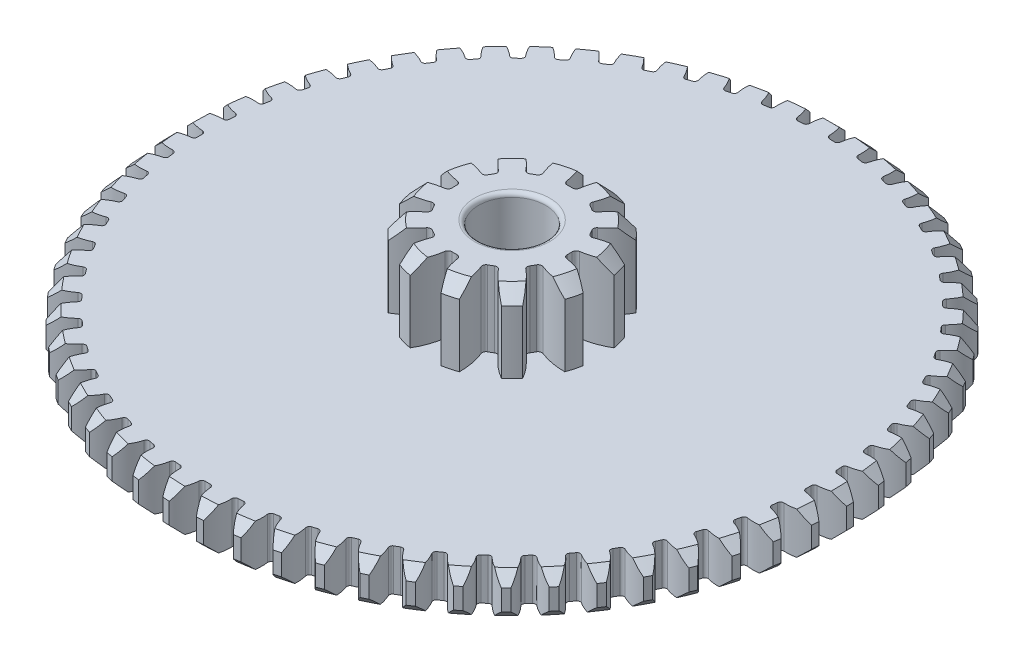
from build123d import *

# Parameters (mm, degrees)
SKETCH1_R                = 2.1
BOSS_EXTRUDE1_DEPTH      = 1.8
CUT_EXTRUDE1_REACH       = 5.473
FILLET1_R                = 0.09
CHAMFER1_SIZE            = 0.3
CIRPATTERN1_COUNT        = 12
FILLET1_OF_CIRPATTERN1_R = 0.09
SKETCH3_R                = 7.875
BOSS_EXTRUDE2_DEPTH      = 1
CUT_EXTRUDE2_REACH       = 13.484
FILLET2_R                = 0.075
CHAMFER2_SIZE            = 0.25
CIRPATTERN2_COUNT        = 61
FILLET2_OF_CIRPATTERN2_R = 0.075
SKETCH5_R                = 0.8
CUT_EXTRUDE3_DEPTH       = 12.482883204
FILLET3_R                = 0.1


with BuildPart() as part:
    # Sketch1 → Boss-Extrude1 (new body)
    with BuildSketch(Plane(origin=(0, 0, 0), x_dir=(1, 0, 0), z_dir=(0, 1, 0))):
        Circle(SKETCH1_R)
    extrude(amount=BOSS_EXTRUDE1_DEPTH)

    # Sketch2 → Cut-Extrude1 (cut, up to next)
    with BuildSketch(Plane(origin=(0, 1.8, 0), x_dir=(1, 0, 0), z_dir=(0, 1, 0)), mode=Mode.PRIVATE) as cut_extrude1_sk1:
        with BuildLine():
            ThreePointArc((-0.140478266, 1.372831329), (-0.216904263, 1.732429305), (-0.368251981, 2.06745991))
            ThreePointArc((-0.368251981, 2.06745991), (0, 2.1), (0.368251981, 2.06745991))
            ThreePointArc((0.368251981, 2.06745991), (0.216904263, 1.732429305), (0.140478266, 1.372831329))
            ThreePointArc((0.140478266, 1.372831329), (0, 1.38), (-0.140478266, 1.372831329))
        make_face()
    cut_extrude1_tool1 = extrude(cut_extrude1_sk1.sketch, amount=-CUT_EXTRUDE1_REACH, mode=Mode.PRIVATE) & part.part
    cut_extrude1 = cut_extrude1_tool1.solids().sort_by_distance((0, 1.8, -1.794061))[0]
    add(cut_extrude1, mode=Mode.SUBTRACT)

    # Fillet1
    fillet1_edges = [part.edges().sort_by_distance(p)[0] for p in [
        (0.140478266, 0.9, -1.372831329),
        (-0.140478266, 0.9, -1.372831329),
    ]]
    fillet(fillet1_edges, radius=FILLET1_R)

    # Chamfer1
    chamfer1_edges = [part.edges().sort_by_distance(p)[0] for p in [
        (0, 1.8, 2.1),
    ]]
    chamfer(chamfer1_edges, length=CHAMFER1_SIZE)

    # CirPattern1: Cut-Extrude1 ×12 about axis
    cirpattern1_axis = Axis((0, 1.8, 0), (0, -1, 0))
    for i in range(1, CIRPATTERN1_COUNT):
        add(cut_extrude1.rotate(cirpattern1_axis, i * 360 / CIRPATTERN1_COUNT), mode=Mode.SUBTRACT)

    # Fillet1 of CirPattern1
    fillet1_of_cirpattern1_edges = [part.edges().sort_by_distance(p)[0] for p in [
        (0.808073411, 0.9, -1.118667673),
        (0.564757917, 0.9, -1.259145939),
        (1.259145939, 0.9, -0.564757917),
        (1.118667673, 0.9, -0.808073411),
        (1.372831329, 0.9, 0.140478266),
        (1.372831329, 0.9, -0.140478266),
        (1.118667673, 0.9, 0.808073411),
        (1.259145939, 0.9, 0.564757917),
        (0.564757917, 0.9, 1.259145939),
        (0.808073411, 0.9, 1.118667673),
        (-0.140478266, 0.9, 1.372831329),
        (0.140478266, 0.9, 1.372831329),
        (-0.808073411, 0.9, 1.118667673),
        (-0.564757917, 0.9, 1.259145939),
        (-1.259145939, 0.9, 0.564757917),
        (-1.118667673, 0.9, 0.808073411),
        (-1.372831329, 0.9, -0.140478266),
        (-1.372831329, 0.9, 0.140478266),
        (-1.118667673, 0.9, -0.808073411),
        (-1.259145939, 0.9, -0.564757917),
        (-0.564757917, 0.9, -1.259145939),
        (-0.808073411, 0.9, -1.118667673),
    ]]
    fillet(fillet1_of_cirpattern1_edges, radius=FILLET1_OF_CIRPATTERN1_R)

    # Sketch3 → Boss-Extrude2 (add)
    with BuildSketch(Plane.XZ):
        Circle(SKETCH3_R)
    extrude(amount=BOSS_EXTRUDE2_DEPTH)

    # Sketch4 → Cut-Extrude2 (cut, up to next)
    with BuildSketch(Plane.XZ.offset(1), mode=Mode.PRIVATE) as cut_extrude2_sk1:
        with BuildLine():
            ThreePointArc((-0.323725699, 7.868343324), (-0.183569923, 7.58532467), (-0.131592414, 7.273809761))
            ThreePointArc((-0.131592414, 7.273809761), (0, 7.275), (0.131592414, 7.273809761))
            ThreePointArc((0.131592414, 7.273809761), (0.183569923, 7.58532467), (0.323725699, 7.868343324))
            ThreePointArc((0.323725699, 7.868343324), (0, 7.875), (-0.323725699, 7.868343324))
        make_face()
    cut_extrude2_tool1 = extrude(cut_extrude2_sk1.sketch, amount=-CUT_EXTRUDE2_REACH, mode=Mode.PRIVATE) & part.part
    cut_extrude2 = cut_extrude2_tool1.solids().sort_by_distance((0, -1, 7.622319))[0]
    add(cut_extrude2, mode=Mode.SUBTRACT)

    # Fillet2
    fillet2_edges = [part.edges().sort_by_distance(p)[0] for p in [
        (0.131592414, -0.5, 7.273809761),
        (-0.131592414, -0.5, 7.273809761),
    ]]
    fillet(fillet2_edges, radius=FILLET2_R)

    # Chamfer2
    chamfer2_edges = [part.edges().sort_by_distance(p)[0] for p in [
        (-5.452810519, 0, -5.681767545),
        (-5.452810519, -1, -5.681767545),
    ]]
    chamfer(chamfer2_edges, length=CHAMFER2_SIZE)

    # CirPattern2: Cut-Extrude2 ×61 about axis
    cirpattern2_axis = Axis((0, -1, 0), (0, 1, 0))
    for i in range(1, CIRPATTERN2_COUNT):
        add(cut_extrude2.rotate(cirpattern2_axis, i * 360 / CIRPATTERN2_COUNT), mode=Mode.SUBTRACT)

    # Fillet2 of CirPattern2
    fillet2_of_cirpattern2_edges = [part.edges().sort_by_distance(p)[0] for p in [
        (0.87879533, -0.5, 7.221727201),
        (0.617005415, -0.5, 7.248788128),
        (1.616682797, -0.5, 7.093092537),
        (1.359062833, -0.5, 7.146927537),
        (2.337433025, -0.5, 6.889269327),
        (2.086713847, -0.5, 6.969307736),
        (3.033405881, -0.5, 6.612418148),
        (2.792245175, -0.5, 6.71781154),
        (3.69722388, -0.5, 6.265473692),
        (3.468178009, -0.5, 6.39510487),
        (4.321850386, -0.5, 5.852113656),
        (4.107347294, -0.5, 6.004608498),
        (4.900664203, -0.5, 5.37671976),
        (4.702977675, -0.5, 5.550461781),
        (5.42752976, -0.5, 4.844331296),
        (5.248755324, -0.5, 5.037478789),
        (5.896862151, -0.5, 4.260591716),
        (5.73889486, -0.5, 4.471097269),
        (6.303686337, -0.5, 3.631688803),
        (6.168200683, -0.5, 3.857321005),
        (6.643689879, -0.5, 2.964289086),
        (6.532122044, -0.5, 3.20265618),
        (6.913268656, -0.5, 2.265467167),
        (6.826801286, -0.5, 2.514042402),
        (7.109565066, -0.5, 1.542630733),
        (7.049114737, -0.5, 1.798779149),
        (7.230498317, -0.5, 0.803442029),
        (7.196705818, -0.5, 1.064448389),
        (7.274786487, -0.5, 0.055736639),
        (7.268010026, -0.5, 0.318834212),
        (7.24196011, -0.5, -0.692559572),
        (7.262271521, -0.5, -0.430159687),
        (7.132367155, -0.5, -1.43351448),
        (7.179551131, -0.5, -1.174593786),
        (6.947169334, -0.5, -2.159273778),
        (7.020725712, -0.5, -1.9065769),
        (6.688329789, -0.5, -2.862144237),
        (6.787478855, -0.5, -2.618349823),
        (6.358592285, -0.5, -3.534675254),
        (6.482283033, -0.5, -3.302367587),
        (5.961452121, -0.5, -4.169737835),
        (6.108373398, -0.5, -3.951379434),
        (5.501119081, -0.5, -4.760600157),
        (5.669713486, -0.5, -4.558505675),
        (4.982472811, -0.5, -5.300998933),
        (5.1709532, -0.5, -5.117310622),
        (4.411011089, -0.5, -5.785205802),
        (4.617379524, -0.5, -5.621870803),
        (3.792791552, -0.5, -6.20808805),
        (4.014860477, -0.5, -6.066837755),
        (3.134367481, -0.5, -6.565163021),
        (3.369782909, -0.5, -6.447494718),
        (2.442718336, -0.5, -6.85264563),
        (2.688984805, -0.5, -6.759806633),
        (1.725175768, -0.5, -7.067488491),
        (1.979682792, -0.5, -7.000462916),
        (0.989345908, -0.5, -7.207414216),
        (1.24939565, -0.5, -7.166912551),
        (0.243028735, -0.5, -7.270939556),
        (0.505864603, -0.5, -7.257391129),
        (-0.505864603, -0.5, -7.257391129),
        (-0.243028735, -0.5, -7.270939556),
        (-1.24939565, -0.5, -7.166912551),
        (-0.989345908, -0.5, -7.207414216),
        (-1.979682792, -0.5, -7.000462916),
        (-1.725175768, -0.5, -7.067488491),
        (-2.688984805, -0.5, -6.759806633),
        (-2.442718336, -0.5, -6.85264563),
        (-3.369782909, -0.5, -6.447494718),
        (-3.134367481, -0.5, -6.565163021),
        (-4.014860477, -0.5, -6.066837755),
        (-3.792791552, -0.5, -6.20808805),
        (-4.617379524, -0.5, -5.621870803),
        (-4.411011089, -0.5, -5.785205802),
        (-5.1709532, -0.5, -5.117310622),
        (-4.982472811, -0.5, -5.300998933),
        (-5.669713486, -0.5, -4.558505675),
        (-5.501119081, -0.5, -4.760600157),
        (-6.108373398, -0.5, -3.951379434),
        (-5.961452121, -0.5, -4.169737835),
        (-6.482283033, -0.5, -3.302367587),
        (-6.358592285, -0.5, -3.534675254),
        (-6.787478855, -0.5, -2.618349823),
        (-6.688329789, -0.5, -2.862144237),
        (-7.020725712, -0.5, -1.9065769),
        (-6.947169334, -0.5, -2.159273778),
        (-7.179551131, -0.5, -1.174593786),
        (-7.132367155, -0.5, -1.43351448),
        (-7.262271521, -0.5, -0.430159687),
        (-7.24196011, -0.5, -0.692559572),
        (-7.268010026, -0.5, 0.318834212),
        (-7.274786487, -0.5, 0.055736639),
        (-7.196705818, -0.5, 1.064448389),
        (-7.230498317, -0.5, 0.803442029),
        (-7.049114737, -0.5, 1.798779149),
        (-7.109565066, -0.5, 1.542630733),
        (-6.826801286, -0.5, 2.514042402),
        (-6.913268656, -0.5, 2.265467167),
        (-6.532122044, -0.5, 3.20265618),
        (-6.643689879, -0.5, 2.964289086),
        (-6.168200683, -0.5, 3.857321005),
        (-6.303686337, -0.5, 3.631688803),
        (-5.73889486, -0.5, 4.471097269),
        (-5.896862151, -0.5, 4.260591716),
        (-5.248755324, -0.5, 5.037478789),
        (-5.42752976, -0.5, 4.844331296),
        (-4.702977675, -0.5, 5.550461781),
        (-4.900664203, -0.5, 5.37671976),
        (-4.107347294, -0.5, 6.004608498),
        (-4.321850386, -0.5, 5.852113656),
        (-3.468178009, -0.5, 6.39510487),
        (-3.69722388, -0.5, 6.265473692),
        (-2.792245175, -0.5, 6.71781154),
        (-3.033405881, -0.5, 6.612418148),
        (-2.086713847, -0.5, 6.969307736),
        (-2.337433025, -0.5, 6.889269327),
        (-1.359062833, -0.5, 7.146927537),
        (-1.616682797, -0.5, 7.093092537),
        (-0.617005415, -0.5, 7.248788128),
        (-0.87879533, -0.5, 7.221727201),
    ]]
    fillet(fillet2_of_cirpattern2_edges, radius=FILLET2_OF_CIRPATTERN2_R)

    # Sketch5 → Cut-Extrude3 (cut, through all)
    with BuildSketch(Plane(origin=(0, 1.8, 0), x_dir=(1, 0, 0), z_dir=(0, 1, 0))):
        Circle(SKETCH5_R)
    extrude(amount=-CUT_EXTRUDE3_DEPTH, mode=Mode.SUBTRACT)

    # Fillet3
    fillet3_edges = [part.edges().sort_by_distance(p)[0] for p in [
        (-0.8, 1.8, 0),
        (-0.8, -1, 0),
    ]]
    fillet(fillet3_edges, radius=FILLET3_R)


solid = part.part
